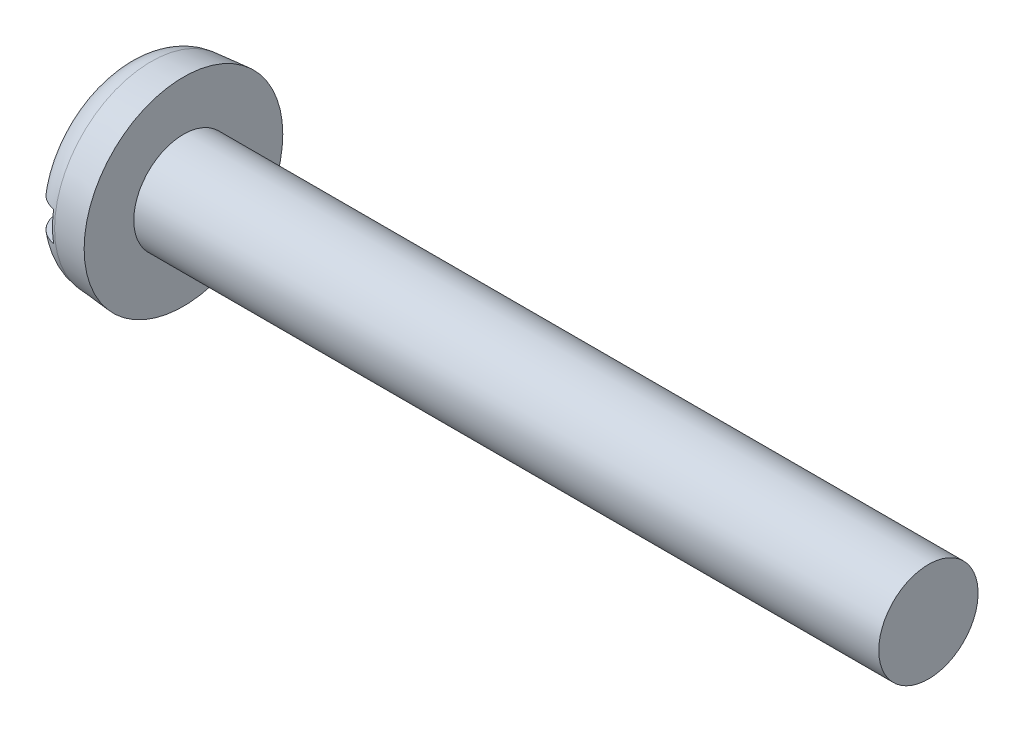
from build123d import *

# Parameters (mm, degrees)
FILLET2_R  = 1.2
SKETCH2_W  = 8
SKETCH2_H  = 1.2
SLOT_DEPTH = 1


with BuildPart() as part:
    # BodySke → Base-Revolve (revolve)
    with BuildSketch(Plane.XY):
        Polygon((2.4, 2), (2.4, 4), (0, 3.790027208), (0, 0), (32.4, 0), (32.4, 2), align=None)
    revolve(axis=Axis((-25.4, 0, 0), (1, 0, 0)))

    # Fillet2
    fillet2_edges = [part.edges().sort_by_distance(p)[0] for p in [
        (0, -3.790027208, 0),
    ]]
    fillet(fillet2_edges, radius=FILLET2_R)

    # Sketch2 → Slot (cut)
    with BuildSketch(Plane(origin=(0, 0, 0), x_dir=(0, 0, -1), z_dir=(1, 0, 0))):
        Rectangle(SKETCH2_W, SKETCH2_H)
    extrude(amount=SLOT_DEPTH, mode=Mode.SUBTRACT)


solid = part.part
